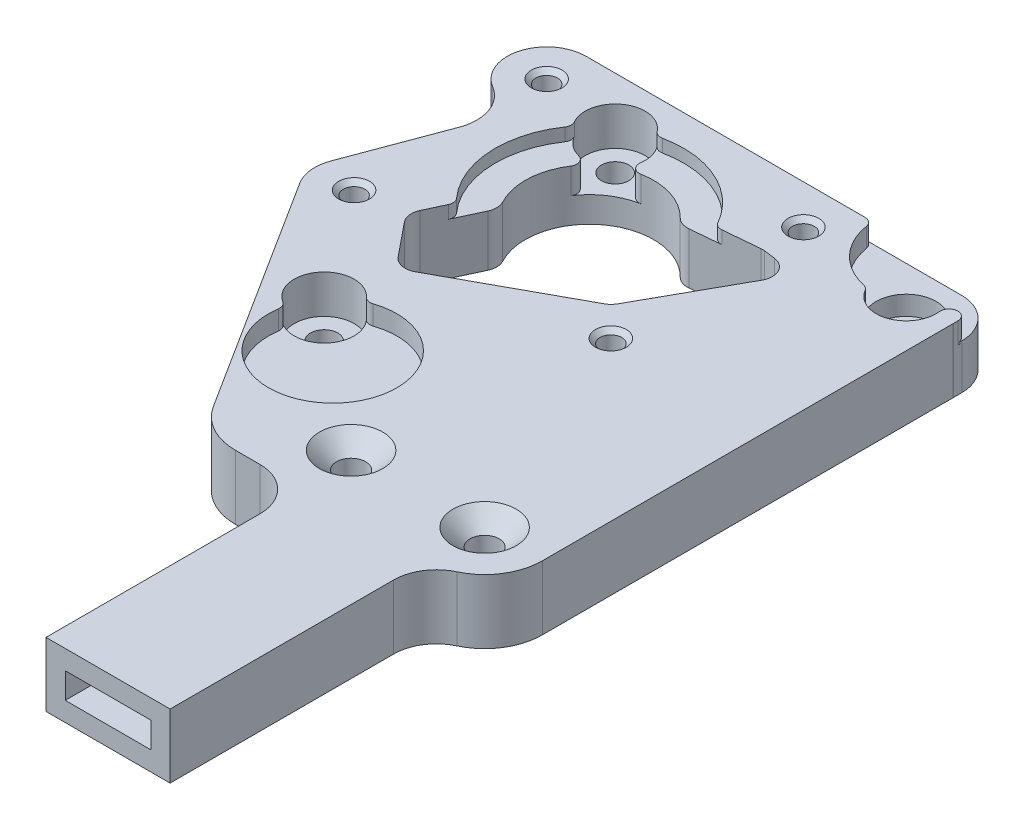
from build123d import *

# Parameters (mm, degrees)
BOSS_EXTRUDE1_DEPTH        = 7.5
CUT_EXTRUDE1_DEPTH         = 2.45
CUT_EXTRUDE2_DEPTH         = 2.25
CUT_EXTRUDE3_DEPTH         = 1.5
CUT_EXTRUDE4_DEPTH         = 3
CUT_EXTRUDE5_DEPTH         = 2.25
DRAFT1_ANGLE               = 45
F_3_2_3_2_DIAMETER_HOLE1_D = 3.2
M2_CLEARANCE_HOLE1_D       = 2.529
M2_CLEARANCE_HOLE2_D       = 2.529
FILLET1_START              = 6
FILLET1_DEPTH              = 2
FILLET1_START_2            = 5.25
FILLET1_2_DEPTH            = 1.45785
FILLET2_R                  = 2
FILLET3_R                  = 4.6
FILLET4_R                  = 5.5
CHAMFER2_SIZE              = 0.5355
SKETCH15_R                 = 1.7
BOSS_EXTRUDE2_DEPTH        = 7.5
SKETCH16_R                 = 7.5
CUT_EXTRUDE6_DEPTH         = 51.631734262
BOSS_EXTRUDE3_START        = 2.25
BOSS_EXTRUDE3_DEPTH        = 2.25
CHAMFER3_SIZE              = 2
SKETCH18_W                 = 14.5
SKETCH18_H                 = 7.5
SKETCH18_W_2               = 10
SKETCH18_H_2               = 3
BOSS_EXTRUDE4_DEPTH        = 30
FILLET5_R                  = 5


with BuildPart() as part:
    # Sketch1 → Boss-Extrude1 (new body)
    with BuildSketch(Plane(origin=(0, 7.5, 0), x_dir=(1, 0, 0), z_dir=(0, 1, 0))):
        with BuildLine():
            Line((33.508791414, 30.373171934), (33.494591401, 33.024635312))
            ThreePointArc((33.494591401, 33.024635312), (32.138627038, 36.261389585), (28.894657368, 37.600000191))
            Line((28.894657368, 37.600000191), (-15.000000337, 37.600000191))
            ThreePointArc((-15.000000337, 37.600000191), (-19.434610369, 34.222388779), (-17.356877162, 29.049667087))
            ThreePointArc((-17.356877162, 29.049667087), (-15.200807807, 26.41157286), (-15.235383316, 23.004670931))
            Line((-15.235383316, 23.004670931), (-20.110241908, 9.967278565))
            Line((-20.110241908, 9.967278565), (-10.643589577, -4.947384576))
            ThreePointArc((-10.643589577, -4.947384576), (-7.177416672, -7.372493833), (-3.014699262, -6.619305089))
            Line((-3.014699262, -6.619305089), (18.314983661, 7.165348002))
            Line((18.314983661, 7.165348002), (33.508791414, 30.373171934))
        make_face()
        with BuildLine():
            Line((5.953705515, 27.561073907), (14.90941878, 28.372926652))
            Line((14.90941878, 28.372926652), (16.439872709, 28.173535922))
            ThreePointArc((16.439872709, 28.173535922), (17.967679799, 27.090037106), (17.928926971, 25.217428657))
            Line((17.928926971, 25.217428657), (11.627622505, 13.899219688))
            Line((11.627622505, 13.899219688), (-4.619579129, 5.021738281))
            Line((-4.619579129, 5.021738281), (-9.616324178, 11.1694391))
            Line((-9.616324178, 11.1694391), (-6.12774016, 18.675558318))
            ThreePointArc((-6.12774016, 18.675558318), (-4.443609513, 29.041881421), (5.953705515, 27.561073907))
        make_face(mode=Mode.SUBTRACT)
    extrude(amount=-BOSS_EXTRUDE1_DEPTH)

    # Sketch2 → Cut-Extrude1 (cut)
    with BuildSketch(Plane(origin=(0, 7.5, 0), x_dir=(-1, 0, 0), z_dir=(0, 1, 0))):
        with BuildLine():
            Line((-33.497145917, -32.54764942), (-33.494591401, -33.024635312))
            ThreePointArc((-33.494591401, -33.024635312), (-33.492579262, -32.86174588), (-33.484800813, -32.699029834))
            ThreePointArc((-33.484800813, -32.699029834), (-33.493851534, -32.623574342), (-33.497145917, -32.54764942))
        make_face()
    extrude(amount=-CUT_EXTRUDE1_DEPTH, mode=Mode.SUBTRACT)

    # Sketch3 → Cut-Extrude2 (cut)
    with BuildSketch(Plane(origin=(0, 7.5, 0), x_dir=(-1, 0, 0), z_dir=(0, 1, 0))):
        with BuildLine():
            Line((-28.894657368, -37.600000191), (-18.491436366, -37.600000191))
            ThreePointArc((-18.491436366, -37.600000191), (-23.607799499, -30.885293511), (-31.730525182, -33.184377023))
            ThreePointArc((-31.730525182, -33.184377023), (-32.763808582, -33.506087854), (-33.484800813, -32.699029834))
            ThreePointArc((-33.484800813, -32.699029834), (-32.252071823, -36.144482371), (-28.894657368, -37.600000191))
        make_face()
    extrude(amount=-CUT_EXTRUDE2_DEPTH, mode=Mode.SUBTRACT)

    # Sketch4 → Cut-Extrude3 (cut)
    with BuildSketch(Plane(origin=(0, 7.5, 0), x_dir=(-1, 0, 0), z_dir=(0, 1, 0))):
        with BuildLine():
            Line((-5.953705515, -27.561073907), (-9.841612021, -27.913520158))
            ThreePointArc((-9.841612021, -27.913520158), (-4.493157895, -33.040494787), (2.893623834, -33.612583988))
            ThreePointArc((2.893623834, -33.612583988), (7.941450772, -34.912175973), (8.683298997, -29.7528003))
            ThreePointArc((8.683298997, -29.7528003), (10.977342797, -22.294353677), (7.747237051, -15.191010811))
            Line((7.747237051, -15.191010811), (6.12774016, -18.675558318))
            ThreePointArc((6.12774016, -18.675558318), (4.443609513, -29.041881421), (-5.953705515, -27.561073907))
        make_face()
    extrude(amount=-CUT_EXTRUDE3_DEPTH, mode=Mode.SUBTRACT)

    # Sketch5 → Cut-Extrude4 (cut)
    with BuildSketch(Plane(origin=(0, 6, 0), x_dir=(-1, 0, 0), z_dir=(0, 1, 0))):
        with BuildLine():
            ThreePointArc((2.535777276, -31.50083979), (7.941450772, -34.912175973), (6.871629886, -28.610271199))
            ThreePointArc((6.871629886, -28.610271199), (6.188596449, -28.004054077), (6.282941422, -27.095685814))
            ThreePointArc((6.282941422, -27.095685814), (4.160251273, -29.240377085), (1.364117032, -30.374902283))
            ThreePointArc((1.364117032, -30.374902283), (2.238897357, -30.637186973), (2.535777276, -31.50083979))
        make_face()
    extrude(amount=-CUT_EXTRUDE4_DEPTH, mode=Mode.SUBTRACT)

    # Sketch6 → Cut-Extrude5 (cut)
    with BuildSketch(Plane(origin=(0, 7.5, 0), x_dir=(-1, 0, 0), z_dir=(0, 1, 0))):
        with BuildLine():
            Line((3.014699262, 6.619305089), (-5.019332498, 1.427181927))
            ThreePointArc((-5.019332498, 1.427181927), (-1.182556182, -0.406183962), (3.034363761, 0.141236513))
            ThreePointArc((3.034363761, 0.141236513), (3.533157671, 4.48287916), (7.877941264, 4.953529517))
            ThreePointArc((7.877941264, 4.953529517), (7.570630335, 6.33394974), (8.951050558, 6.64126067))
            ThreePointArc((8.951050558, 6.64126067), (5.979658402, 7.499962383), (3.014699262, 6.619305089))
        make_face()
    extrude(amount=-CUT_EXTRUDE5_DEPTH, mode=Mode.SUBTRACT)

    # Draft1
    draft1_faces = [part.faces().sort_by_distance(p)[0] for p in [
        (33.492642897, 5.05, -32.742645392),
    ]]
    draft(draft1_faces, Plane(origin=(33.508791414, 0, -30.373171934), x_dir=(0.005355461101285183, 0, 0.9999856594153701), z_dir=(0.9999856594153701, 0, -0.005355461101285183)), DRAFT1_ANGLE)

    # Sketch7 → Cut-Revolve1 (revolve, cut)
    with BuildSketch(Plane(origin=(0, 0, -32), x_dir=(-1, 0, 0), z_dir=(0, 0, -1)), mode=Mode.PRIVATE) as cut_revolve1_sk:
        Polygon((-29.6, 0), (-28, 0), (-28, 7.5), (-31.5, 7.5), (-31.5, 3), (-29.6, 3), align=None)
    revolve(cut_revolve1_sk.sketch.rotate(Axis((28, 0, -32), (0, 1, 0)), 270), axis=Axis((28, 0, -32), (0, 1, 0)), mode=Mode.SUBTRACT)

    # Sketch8 → Cut-Revolve2 (revolve, cut)
    with BuildSketch(Plane(origin=(0, 0, 2), x_dir=(-1, 0, 0), z_dir=(0, 0, -1)), mode=Mode.PRIVATE) as cut_revolve2_sk:
        Polygon((4.4, 0), (6, 0), (6, 7.5), (2.5, 7.5), (2.5, 3), (4.4, 3), align=None)
    revolve(cut_revolve2_sk.sketch.rotate(Axis((-6, 0, 2), (0, 1, 0)), 270), axis=Axis((-6, 0, 2), (0, 1, 0)), mode=Mode.SUBTRACT)

    # Ø3.2 (3.2) Diameter Hole1 (through all)
    with Locations(Plane(origin=(0, 3, 0), x_dir=(1, 0, 0), z_dir=(0, 1, 0))):
        with Locations((-6, 32)):
            Hole(F_3_2_3_2_DIAMETER_HOLE1_D / 2)

    # M2 Clearance Hole1 (through all)
    with Locations(Plane(origin=(0, 7.5, 0), x_dir=(1, 0, 0), z_dir=(0, 1, 0))):
        with Locations((-15.000000337, 10.500000191), (14.999999663, 10.500000191)):
            Hole(M2_CLEARANCE_HOLE1_D / 2)

    # M2 Clearance Hole2 (through all)
    with Locations(Plane(origin=(0, 0, 0), x_dir=(-1, 0, 0), z_dir=(0, -1, 0))):
        with Locations((15.000000337, 33.000000191), (-14.999999663, 33.000000191)):
            Hole(M2_CLEARANCE_HOLE2_D / 2)

    # Fillet1: read off the stored shape, not the designer's step
    # Fillet1 outline → Fillet1 (cut)
    with BuildSketch(Plane(origin=(0, 0, 0), x_dir=(1, 0, 0), z_dir=(0, 1, 0)).offset(FILLET1_START)):
        with BuildLine():
            ThreePointArc((-3.034363761, -0.141236513), (-2.711418413, -0.00727448), (-2.382580753, 0.111491332))
            ThreePointArc((-2.382580753, 0.111491332), (-2.94758878, 0.090759023), (-3.433534146, 0.379759025))
            ThreePointArc((-3.433534146, 0.379759025), (-3.221709612, 0.128638654), (-3.034363761, -0.141236513))
        make_face()
        with BuildLine():
            ThreePointArc((5.631594691, -1.031497568), (5.054763815, -1.191044082), (4.490128887, -0.992609337))
            ThreePointArc((4.490128887, -0.992609337), (4.759692983, -1.20385277), (5.019332498, -1.427181927))
            Line((5.019332498, -1.427181927), (5.631594691, -1.031497568))
        make_face()
        with BuildLine():
            ThreePointArc((10.500336649, 27.973234821), (9.94838279, 28.082100438), (9.542550367, 28.471721829))
            ThreePointArc((9.542550367, 28.471721829), (9.696098966, 28.194773551), (9.841612021, 27.913520158))
            Line((9.841612021, 27.913520158), (10.500336649, 27.973234821))
        make_face()
        with BuildLine():
            ThreePointArc((-2.234706741, 33.770612057), (-2.784899636, 33.811907429), (-3.229448171, 34.138701139))
            ThreePointArc((-3.229448171, 34.138701139), (-3.049784673, 33.883143521), (-2.893623835, 33.612583987))
            ThreePointArc((-2.893623835, 33.612583987), (-2.565382396, 33.696672904), (-2.234706741, 33.770612057))
        make_face()
        with BuildLine():
            ThreePointArc((-7.747237051, 15.191010811), (-7.974899066, 15.423656634), (-8.195577832, 15.662936709))
            ThreePointArc((-8.195577832, 15.662936709), (-7.951497485, 15.142955041), (-8.033787627, 14.574461871))
            Line((-8.033787627, 14.574461871), (-7.747237051, 15.191010811))
        make_face()
        with BuildLine():
            ThreePointArc((-8.683298997, 29.7528003), (-8.872984413, 30.001010114), (-9.039782423, 30.265144725))
            ThreePointArc((-9.039782423, 30.265144725), (-8.909106864, 29.72910235), (-9.08260068, 29.20534914))
            ThreePointArc((-9.08260068, 29.20534914), (-8.887166226, 29.482150082), (-8.683298997, 29.7528003))
        make_face()
        with BuildLine():
            ThreePointArc((17.596848914, 37.600000191), (18.24310511, 37.363120712), (18.583191644, 36.764706051))
            ThreePointArc((18.583191644, 36.764706051), (18.525606258, 37.18106705), (18.491436366, 37.600000191))
            Line((18.491436366, 37.600000191), (17.596848914, 37.600000191))
        make_face()
        with BuildLine():
            ThreePointArc((31.47735426, 32.397501388), (31.513820005, 32.800949768), (31.707340291, 33.156829305))
            ThreePointArc((31.707340291, 33.156829305), (31.557730942, 32.9852798), (31.402984615, 32.818349381))
            ThreePointArc((31.402984615, 32.818349381), (31.446598906, 32.60906156), (31.47735426, 32.397501388))
        make_face()
        with BuildLine():
            ThreePointArc((24.989862222, 30.214203103), (24.88644986, 30.401311311), (24.79465386, 30.594384076))
            ThreePointArc((24.79465386, 30.594384076), (24.570467623, 30.633788663), (24.347580417, 30.67997831))
            ThreePointArc((24.347580417, 30.67997831), (24.716890305, 30.513513441), (24.989862222, 30.214203103))
        make_face()
    extrude(amount=FILLET1_DEPTH, mode=Mode.SUBTRACT)

    # Fillet1 2 outline → Fillet1 2 (cut)
    with BuildSketch(Plane(origin=(0, 0, 0), x_dir=(1, 0, 0), z_dir=(0, 1, 0)).offset(FILLET1_START_2)):
        with BuildLine():
            ThreePointArc((-3.034363761, -0.141236513), (-2.711418413, -0.00727448), (-2.382580753, 0.111491332))
            ThreePointArc((-2.382580753, 0.111491332), (-2.94758878, 0.090759023), (-3.433534146, 0.379759025))
            ThreePointArc((-3.433534146, 0.379759025), (-3.221709612, 0.128638654), (-3.034363761, -0.141236513))
        make_face()
        with BuildLine():
            ThreePointArc((5.631594691, -1.031497568), (5.054763815, -1.191044082), (4.490128887, -0.992609337))
            ThreePointArc((4.490128887, -0.992609337), (4.759692983, -1.20385277), (5.019332498, -1.427181927))
            Line((5.019332498, -1.427181927), (5.631594691, -1.031497568))
        make_face()
        with BuildLine():
            ThreePointArc((17.596848914, 37.600000191), (18.24310511, 37.363120712), (18.583191644, 36.764706051))
            ThreePointArc((18.583191644, 36.764706051), (18.525606258, 37.18106705), (18.491436366, 37.600000191))
            Line((18.491436366, 37.600000191), (17.596848914, 37.600000191))
        make_face()
        with BuildLine():
            ThreePointArc((31.47735426, 32.397501388), (31.513820005, 32.800949768), (31.707340291, 33.156829305))
            ThreePointArc((31.707340291, 33.156829305), (31.557730942, 32.9852798), (31.402984615, 32.818349381))
            ThreePointArc((31.402984615, 32.818349381), (31.446598906, 32.60906156), (31.47735426, 32.397501388))
        make_face()
        with BuildLine():
            ThreePointArc((24.989862222, 30.214203103), (24.88644986, 30.401311311), (24.79465386, 30.594384076))
            ThreePointArc((24.79465386, 30.594384076), (24.570467623, 30.633788663), (24.347580417, 30.67997831))
            ThreePointArc((24.347580417, 30.67997831), (24.716890305, 30.513513441), (24.989862222, 30.214203103))
        make_face()
    extrude(amount=FILLET1_2_DEPTH, mode=Mode.SUBTRACT)

    # Fillet2
    fillet2_edges = [part.edges().sort_by_distance(p)[0] for p in [
        (-6.12774016, 3, -18.675558318),
        (5.953705515, 3, -27.561073907),
        (14.90941878, 3.75, -28.372926652),
        (11.627622505, 3.75, -13.899219688),
        (-4.619579129, 3.75, -5.021738281),
        (-9.616324178, 3.75, -11.1694391),
    ]]
    fillet(fillet2_edges, radius=FILLET2_R)

    # Fillet3
    fillet3_edges = [part.edges().sort_by_distance(p)[0] for p in [
        (18.314983661, 3.75, -7.165348002),
        (-20.110241908, 3.75, -9.967278565),
    ]]
    fillet(fillet3_edges, radius=FILLET3_R)

    # Fillet4
    fillet4_edges = [part.edges().sort_by_distance(p)[0] for p in [
        (33.508791414, 3.75, -30.373171934),
    ]]
    fillet(fillet4_edges, radius=FILLET4_R)

    # Chamfer2
    chamfer2_edges = [part.edges().sort_by_distance(p)[0] for p in [
        (16.264499663, 7.5, -10.500000191),
        (16.264499663, 0, -10.500000191),
        (-13.735500337, 7.5, -10.500000191),
        (-13.735500337, 0, -10.500000191),
        (13.735499663, 0, -33.000000191),
        (13.735499663, 7.5, -33.000000191),
        (-16.264500337, 0, -33.000000191),
        (-16.264500337, 7.5, -33.000000191),
    ]]
    chamfer(chamfer2_edges, length=CHAMFER2_SIZE)

    # Sketch15 → Boss-Extrude2 (add)
    with BuildSketch(Plane(origin=(0, 7.5, 0), x_dir=(1, 0, 0), z_dir=(0, 1, 0))):
        with BuildLine():
            Line((33.499921127, 32.029455036), (33.499921127, -16))
            ThreePointArc((33.499921127, -16), (31.5228919, -20.772970773), (26.749921127, -22.75))
            Line((26.749921127, -22.75), (4.366631947, -22.75))
            ThreePointArc((4.366631947, -22.75), (1.115009412, -21.915188153), (-1.332318897, -19.617244707))
            Line((-1.332318897, -19.617244707), (-10.643589577, -4.947384576))
            ThreePointArc((-10.643589577, -4.947384576), (-7.177416672, -7.372493833), (-3.014699262, -6.619305089))
            Line((-3.014699262, -6.619305089), (17.496796644, 6.636581389))
            ThreePointArc((17.496796644, 6.636581389), (18.243055911, 7.237702508), (18.848581021, 7.980392775))
            Line((18.848581021, 7.980392775), (32.601564667, 28.987425916))
            ThreePointArc((32.601564667, 28.987425916), (33.270637908, 30.443502208), (33.499921127, 32.029455036))
        make_face()
        with Locations(Location((26.75, -16, 0), (0, 0, 270))):
            Circle(SKETCH15_R, mode=Mode.SUBTRACT)
        with Locations(Location((11.15, -16, 0), (0, 0, 270))):
            Circle(SKETCH15_R, mode=Mode.SUBTRACT)
    extrude(amount=-BOSS_EXTRUDE2_DEPTH)

    # Sketch16 → Cut-Extrude6 (cut, through all)
    with BuildSketch(Plane(origin=(0, 5.25, 0), x_dir=(1, 0, 0), z_dir=(0, 1, 0))):
        with Locations((0, -7)):
            Circle(SKETCH16_R)
    extrude(amount=CUT_EXTRUDE6_DEPTH, mode=Mode.SUBTRACT)

    # Sketch17 → Boss-Extrude3 (add)
    with BuildSketch(Plane(origin=(0, 5.25, 0), x_dir=(1, 0, 0), z_dir=(0, 1, 0)).offset(BOSS_EXTRUDE3_START)):
        with BuildLine():
            Line((5.631594691, -1.031497568), (5.019332498, -1.427181927))
            ThreePointArc((5.019332498, -1.427181927), (4.759692983, -1.20385277), (4.490128887, -0.992609337))
            ThreePointArc((4.490128887, -0.992609337), (5.054763815, -1.191044082), (5.631594691, -1.031497568))
        make_face()
        with BuildLine():
            ThreePointArc((-7.424555216, -5.938878024), (-7.490082083, -6.614422014), (-7.494269712, -7.293123655))
            ThreePointArc((-7.494269712, -7.293123655), (-8.246430372, -7.020313794), (-8.951050558, -6.64126067))
            ThreePointArc((-8.951050558, -6.64126067), (-7.996494628, -6.70584153), (-7.424555216, -5.938878024))
        make_face()
    extrude(amount=-BOSS_EXTRUDE3_DEPTH)

    # Chamfer3
    chamfer3_edges = [part.edges().sort_by_distance(p)[0] for p in [
        (26.75, 7.5, 14.3),
        (11.15, 7.5, 14.3),
    ]]
    chamfer(chamfer3_edges, length=CHAMFER3_SIZE)

    # Sketch18 → Boss-Extrude4 (add)
    with BuildSketch(Plane.XY.offset(22.75)):
        with Locations((19.499921127, 3.75)):
            Rectangle(SKETCH18_W, SKETCH18_H)
        with Locations((19.499921127, 3.75)):
            Rectangle(SKETCH18_W_2, SKETCH18_H_2, mode=Mode.SUBTRACT)
    extrude(amount=BOSS_EXTRUDE4_DEPTH)

    # Fillet5
    fillet5_edges = [part.edges().sort_by_distance(p)[0] for p in [
        (26.749921127, 3.75, 22.75),
        (12.249921127, 3.75, 22.75),
    ]]
    fillet(fillet5_edges, radius=FILLET5_R)


solid = part.part
